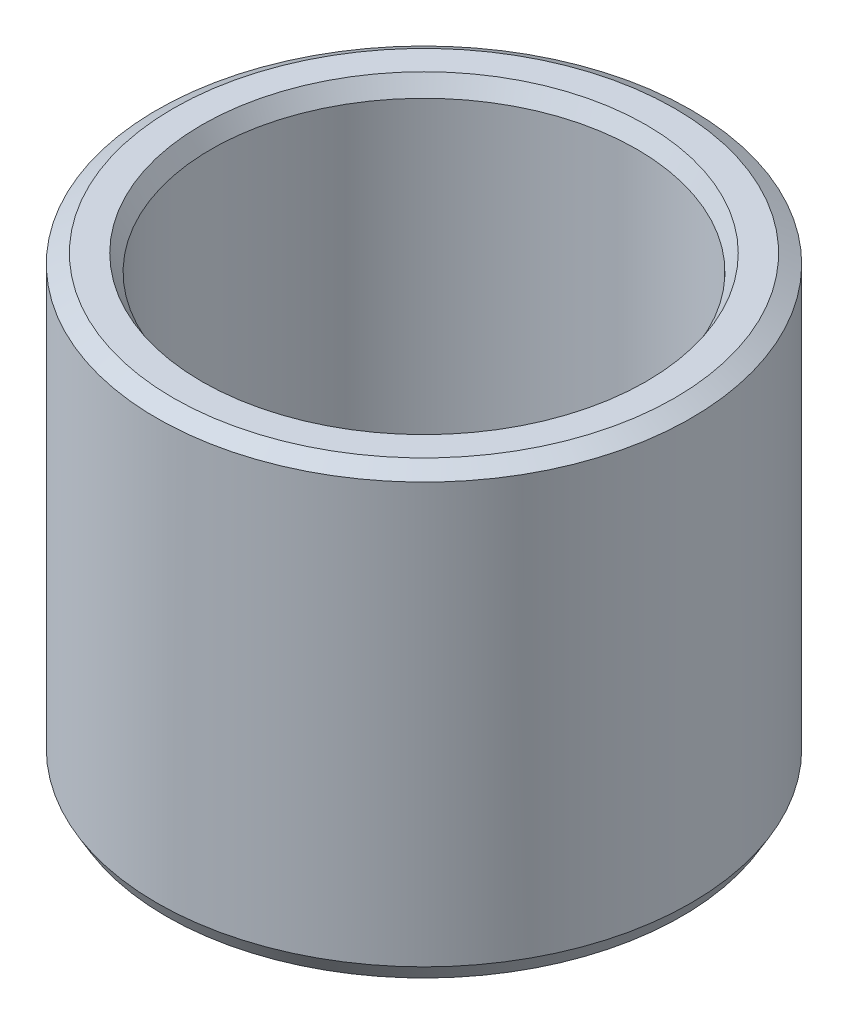
from build123d import *
from OCP.BRepFilletAPI import BRepFilletAPI_MakeChamfer

# Parameters (mm, degrees)
SKETCH1_R           = 50
BOSS_EXTRUDE1_DEPTH = 83.408632358
SKETCH2_R           = 39.84107528
CUT_EXTRUDE1_DEPTH  = 110.348067893
CHAMFER1_SIZE       = 1.76290098
CHAMFER1_SIZE2      = 3.053434066


with BuildPart() as part:
    # Sketch1 → Boss-Extrude1 (new body)
    with BuildSketch(Plane(origin=(0, 0, 0), x_dir=(1, 0, 0), z_dir=(0, 1, 0))):
        Circle(SKETCH1_R)
    extrude(amount=BOSS_EXTRUDE1_DEPTH)

    # Sketch2 → Cut-Extrude1 (cut, through all)
    with BuildSketch(Plane(origin=(0, 0, 0), x_dir=(1, 0, 0), z_dir=(0, 1, 0))):
        Circle(SKETCH2_R)
    extrude(amount=CUT_EXTRUDE1_DEPTH, mode=Mode.SUBTRACT)

    # Chamfer1: one chamfer whose edges measure the first distance from different faces: ONE call of the kernel's chamfer builder (chamfer() names one face for all edges)
    chamfer1_edges_1 = [part.edges().sort_by_distance(p)[0] for p in [
        (-39.84107528, 83.408632358, 0),
    ]]
    chamfer1_side_1 = [part.faces().sort_by_distance(p)[0] for p in [
        (-48.585786438, 83.408632358, 0),
    ]]
    chamfer1_edges_2 = [part.edges().sort_by_distance(p)[0] for p in [
        (-39.84107528, 0, 0),
    ]]
    chamfer1_side_2 = [part.faces().sort_by_distance(p)[0] for p in [
        (-39.84107528, 41.704316179, 0),
    ]]
    chamfer1_edges_3 = [part.edges().sort_by_distance(p)[0] for p in [
        (-50, 0, 0),
    ]]
    chamfer1_side_3 = [part.faces().sort_by_distance(p)[0] for p in [
        (-48.585786438, 0, 0),
    ]]
    chamfer1_edges_4 = [part.edges().sort_by_distance(p)[0] for p in [
        (-50, 83.408632358, 0),
    ]]
    chamfer1_side_4 = [part.faces().sort_by_distance(p)[0] for p in [
        (-50, 41.704316179, 0),
    ]]
    chamfer1 = BRepFilletAPI_MakeChamfer(part.part.solid().wrapped)
    for e in chamfer1_edges_1:
        chamfer1.Add(CHAMFER1_SIZE, CHAMFER1_SIZE2, e.wrapped, chamfer1_side_1[0].wrapped)  # the first distance lies on this face
    for e in chamfer1_edges_2:
        chamfer1.Add(CHAMFER1_SIZE, CHAMFER1_SIZE2, e.wrapped, chamfer1_side_2[0].wrapped)  # the first distance lies on this face
    for e in chamfer1_edges_3:
        chamfer1.Add(CHAMFER1_SIZE, CHAMFER1_SIZE2, e.wrapped, chamfer1_side_3[0].wrapped)  # the first distance lies on this face
    for e in chamfer1_edges_4:
        chamfer1.Add(CHAMFER1_SIZE, CHAMFER1_SIZE2, e.wrapped, chamfer1_side_4[0].wrapped)  # the first distance lies on this face
    add(Compound.cast(chamfer1.Shape()), mode=Mode.REPLACE)


solid = part.part
